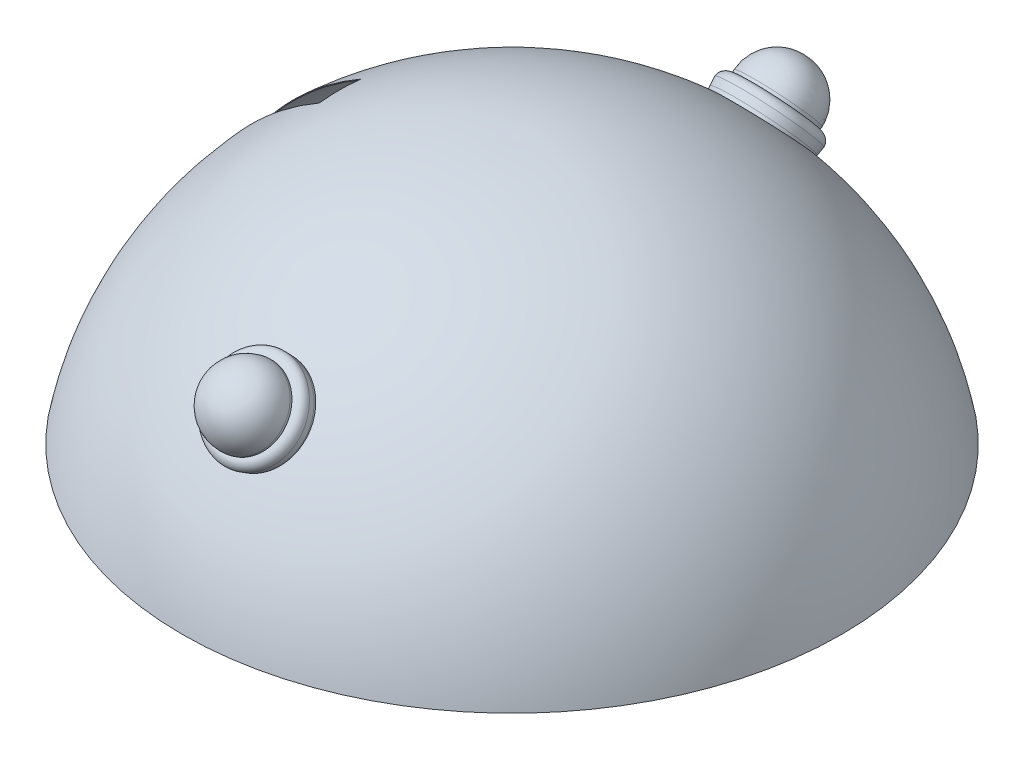
from build123d import *

# Parameters (mm, degrees)
SKETCH3_W          = 33
SKETCH3_H          = 85
CUT_EXTRUDE1_DEPTH = 427.56401826


# Read off the part's stored shape, not the designer's step: Shell1
with BuildPart() as part:
    # Sketch2 → Revolve1 (revolve)
    with BuildSketch(Plane(origin=(0, 0, 0), x_dir=(0, 0, -1), z_dir=(1, 0, 0))):
        with BuildLine():
            Line((0, 0), (262.5, 0))
            ThreePointArc((262.5, 0), (169.771314506, 153.151643133), (0, 210))
            Line((0, 210), (0, 0))
        make_face()
    revolve(axis=Axis((0, 0, 0), (0, 1, 0)))

    # Shell1 outline → Shell1 (revolve, cut)
    with BuildSketch(Plane.XY):
        with BuildLine():
            add(Edge.make_bspline(
                [(261.990541394, 0), (249.393154268, 64.395947541), (213.986497673, 135.054668864), (150.420821974, 187.975061522), (73.700323877, 209.605596522), (5.918689002, 209.605596125), (4.433063666, 209.594907195), (2.951321059, 209.573636944), (1.473591309, 209.54189575), (0, 209.499796384)],
                knots=[4.714725531, 4.714725531, 4.714725531, 4.714725531, 4.714725531, 4.714725531, 6.090001044, 6.090001044, 6.090001044, 6.090001044, 6.120899054, 6.120899054, 6.120899054, 6.120899054, 6.120899054, 6.120899054], degree=5, weights=[1, 1, 0.979431299, 0.979005244, 1, 1, 1.000000001, 1.000000001, 1, 1]))
            Line((0, 209.499796384), (0, 0))
            Line((0, 0), (261.990541394, 0))
        make_face()
    revolve(axis=Axis((0, 0, 0), (0, 1, 0)), mode=Mode.SUBTRACT)

    # Sketch3 → Cut-Extrude1 (cut, through all)
    with BuildSketch(Plane(origin=(0, 0, 0), x_dir=(0, 0, -1), z_dir=(1, 0, 0))):
        with Locations((0, 132.5)):
            Rectangle(SKETCH3_W, SKETCH3_H)
    extrude(amount=-CUT_EXTRUDE1_DEPTH, mode=Mode.SUBTRACT)

    # Sketch4 → Revolve2 (revolve)
    with BuildSketch(Plane(origin=(0, 0, 0), x_dir=(0, 0, -1), z_dir=(1, 0, 0))):
        with BuildLine():
            ThreePointArc((210.291096266, 131.255692647), (219.957150511, 120.181563837), (228.761945789, 108.411070488))
            Line((228.761945789, 108.411070488), (230.623541629, 109.697164434))
            ThreePointArc((230.623541629, 109.697164434), (240.743234449, 129.541865223), (233.835220152, 150.719676031))
            Line((233.835220152, 150.719676031), (210.291096266, 131.255692647))
        make_face()
        with BuildLine():
            ThreePointArc((228.166256989, 98.428828513), (230.531491394, 103.296578311), (228.761945789, 108.411070488))
            ThreePointArc((228.761945789, 108.411070488), (219.957150511, 120.181563837), (210.291096266, 131.255692647))
            Line((210.291096266, 131.255692647), (205.656786356, 127.424497588))
            ThreePointArc((205.656786356, 127.424497588), (217.616805621, 113.474178208), (228.166256989, 98.428828513))
        make_face()
        with BuildLine():
            Line((223.123961345, 95.176297364), (228.166256989, 98.428828513))
            ThreePointArc((228.166256989, 98.428828513), (217.616805621, 113.474178208), (205.656786356, 127.424497588))
            Line((205.656786356, 127.424497588), (201.021822895, 123.592762238))
            ThreePointArc((201.021822895, 123.592762238), (212.773027584, 109.929090534), (223.123961345, 95.176297364))
        make_face()
        with BuildLine():
            ThreePointArc((218.048667327, 91.976080085), (208.036950105, 106.245400792), (196.670851057, 119.461292273))
            Line((196.670851057, 119.461292273), (201.021822895, 123.592762238))
            ThreePointArc((201.021822895, 123.592762238), (212.773027584, 109.929090534), (223.123961345, 95.176297364))
            Line((223.123961345, 95.176297364), (218.048667327, 91.976080085))
        make_face()
    revolve2 = revolve(axis=Axis((0, 123.592762238, -201.021822895), (0, 0.6371633370166178, -0.7707287992295655)))

    # Mirror1: Revolve2 across plane
    add(revolve2.mirror(Plane.XY))


solid = part.part
